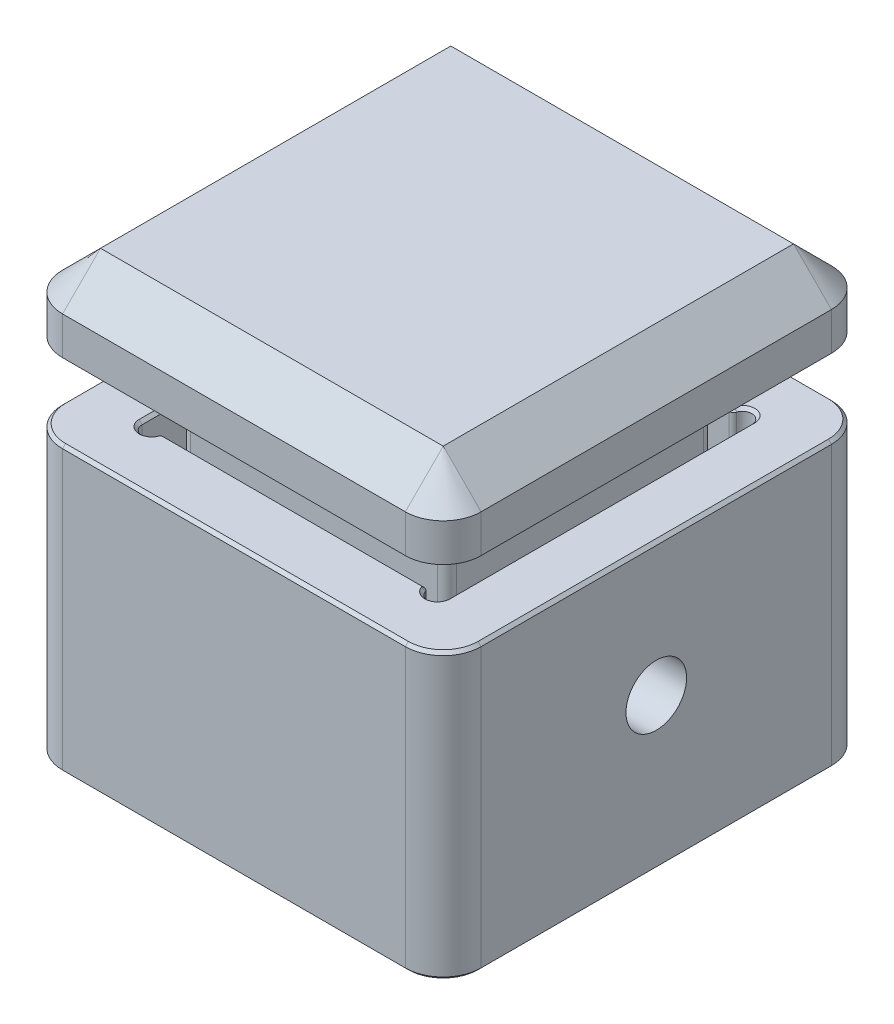
from build123d import *

# Parameters (mm, degrees)
SKETCH1_W           = 35.052
SKETCH1_H           = 35.687
BOSS_EXTRUDE1_DEPTH = 23.8125
FILLET1_R           = 3.175
FILLET2_R           = 0.4
SKETCH2_W           = 22.2758
SKETCH2_H           = 22.2758
BOSS_EXTRUDE2_DEPTH = 6.35
SKETCH2_4_W         = 22.2758
SKETCH2_4_H         = 22.2758
BOSS_EXTRUDE3_DEPTH = 30.1625
CHAMFER1_SIZE       = 3.175
CHAMFER2_SIZE       = 4.7625
CHAMFER3_SIZE       = 0.254
FILLET3_R           = 0.810638298
SKETCH3_R           = 2.54
CUT_EXTRUDE1_DEPTH  = 60.148912156


with BuildPart() as part:
    # Sketch1 → Boss-Extrude1 (new body)
    with BuildSketch(Plane(origin=(0, 0, 0), x_dir=(1, 0, 0), z_dir=(0, 1, 0))):
        with Locations((12.7635, 12.7635)):
            Rectangle(SKETCH1_W, SKETCH1_H)
        with BuildLine():
            Line((1.599999848, 0), (23.927000152, 0))
            ThreePointArc((23.927000152, 0), (24.727000076, -0.799999924), (25.527, 0))
            Line((25.527, 0), (25.527, 25.527))
            ThreePointArc((25.527, 25.527), (24.727000076, 26.326999924), (23.927000152, 25.527))
            Line((23.927000152, 25.527), (1.599999848, 25.527))
            ThreePointArc((1.599999848, 25.527), (0.799999924, 26.326999924), (0, 25.527))
            Line((0, 25.527), (0, 0))
            ThreePointArc((0, 0), (0.799999924, -0.799999924), (1.599999848, 0))
        make_face(mode=Mode.SUBTRACT)
    extrude(amount=BOSS_EXTRUDE1_DEPTH)

    # Fillet1
    fillet1_edges = [part.edges().sort_by_distance(p)[0] for p in [
        (-4.7625, 11.90625, -30.607),
        (30.2895, 11.90625, -30.607),
        (30.2895, 11.90625, 5.08),
        (-4.7625, 11.90625, 5.08),
    ]]
    fillet(fillet1_edges, radius=FILLET1_R)

    # Fillet2
    fillet2_edges = [part.edges().sort_by_distance(p)[0] for p in [
        (1.599999848, 11.90625, 0),
        (23.927000152, 11.90625, 0),
        (23.927000152, 11.90625, -25.527),
        (1.599999848, 11.90625, -25.527),
    ]]
    fillet(fillet2_edges, radius=FILLET2_R)

    # Chamfer3
    chamfer3_edges = [part.edges().sort_by_distance(p)[0] for p in [
        (0.664718345, 0, 0.788478771),
        (25.527, 0, -12.7635),
        (24.862281655, 0, -26.315478771),
        (0, 0, -12.7635),
        (0.664718345, 23.8125, 0.788478771),
        (25.527, 23.8125, -12.7635),
        (24.862281655, 23.8125, -26.315478771),
        (0, 23.8125, -12.7635),
        (-4.7625, 0, -12.7635),
        (-4.7625, 23.8125, -12.7635),
        (12.7635, 0, -30.607),
        (30.2895, 0, -12.7635),
        (12.7635, 0, 5.08),
        (-3.83256403, 0, 4.15006403),
        (29.35956403, 0, 4.15006403),
        (29.35956403, 0, -29.67706403),
        (-3.83256403, 0, -29.67706403),
        (12.7635, 23.8125, -30.607),
        (12.7635, 23.8125, 5.08),
        (30.2895, 23.8125, -12.7635),
        (-3.83256403, 23.8125, 4.15006403),
        (29.35956403, 23.8125, 4.15006403),
        (29.35956403, 23.8125, -29.67706403),
        (-3.83256403, 23.8125, -29.67706403),
        (12.7635, 0, 0),
        (12.7635, 23.8125, 0),
        (24.862281655, 0, 0.788478771),
        (12.7635, 0, -25.527),
        (0.664718345, 0, -26.315478771),
        (1.700430589, 0, 0.073401365),
        (1.700430589, 0, -25.600401365),
        (23.826569411, 0, -25.600401365),
        (23.826569411, 0, 0.073401365),
        (24.862281655, 23.8125, 0.788478771),
        (0.664718345, 23.8125, -26.315478771),
        (12.7635, 23.8125, -25.527),
        (1.700430589, 23.8125, 0.073401365),
        (1.700430589, 23.8125, -25.600401365),
        (23.826569411, 23.8125, -25.600401365),
        (23.826569411, 23.8125, 0.073401365),
    ]]
    chamfer(chamfer3_edges, length=CHAMFER3_SIZE)


with BuildPart() as body_2:
    # Sketch2 → Boss-Extrude2 (new body)
    # profile 1 of 2: a face of its own
    with BuildSketch(Plane(origin=(0, 30.1625, 0), x_dir=(1, 0, 0), z_dir=(0, 1, 0))):
        with BuildLine():
            Line((30.2895, -1.905), (30.2895, 27.432))
            ThreePointArc((30.2895, 27.432), (29.35956403, 29.67706403), (27.1145, 30.607))
            Line((27.1145, 30.607), (-1.5875, 30.607))
            ThreePointArc((-1.5875, 30.607), (-3.83256403, 29.67706403), (-4.7625, 27.432))
            Line((-4.7625, 27.432), (-4.7625, -1.905))
            ThreePointArc((-4.7625, -1.905), (-3.83256403, -4.15006403), (-1.5875, -5.08))
            Line((-1.5875, -5.08), (27.1145, -5.08))
            ThreePointArc((27.1145, -5.08), (29.35956403, -4.15006403), (30.2895, -1.905))
        make_face()
        with Locations((12.7635, 12.7635)):
            Rectangle(SKETCH2_W, SKETCH2_H, mode=Mode.SUBTRACT)
    # profile 2 of 2: a face of its own
    with BuildSketch(Plane(origin=(0, 30.1625, 0), x_dir=(1, 0, 0), z_dir=(0, 1, 0))):
        with Locations((12.7635, 12.7635)):
            Rectangle(SKETCH2_W, SKETCH2_H)
    extrude(amount=BOSS_EXTRUDE2_DEPTH)

    # Sketch2<4> → Boss-Extrude3 (add)
    with BuildSketch(Plane(origin=(0, 30.1625, 0), x_dir=(1, 0, 0), z_dir=(0, 1, 0))):
        with Locations((12.7635, 12.7635)):
            Rectangle(SKETCH2_4_W, SKETCH2_4_H)
    extrude(amount=-BOSS_EXTRUDE3_DEPTH)

    # Chamfer1
    chamfer1_edges = [body_2.edges().sort_by_distance(p)[0] for p in [
        (29.35956403, 36.5125, -29.67706403),
        (12.7635, 36.5125, -30.607),
        (-3.83256403, 36.5125, -29.67706403),
        (-4.7625, 36.5125, -12.7635),
        (-3.83256403, 36.5125, 4.15006403),
        (12.7635, 36.5125, 5.08),
        (29.35956403, 36.5125, 4.15006403),
        (30.2895, 36.5125, -12.7635),
    ]]
    chamfer(chamfer1_edges, length=CHAMFER1_SIZE - 0.0001)  # a hair under: the kernel refuses the full size

    # Chamfer2
    chamfer2_edges = [body_2.edges().sort_by_distance(p)[0] for p in [
        (1.6256, 0, -12.7635),
        (12.7635, 0, -23.9014),
        (23.9014, 0, -12.7635),
        (12.7635, 0, -1.6256),
    ]]
    chamfer(chamfer2_edges, length=CHAMFER2_SIZE)

    # Fillet3
    fillet3_edges = [body_2.edges().sort_by_distance(p)[0] for p in [
        (1.6256, 17.4625, -23.9014),
        (1.6256, 17.4625, -1.6256),
        (23.9014, 17.4625, -1.6256),
        (23.9014, 17.4625, -23.9014),
    ]]
    fillet(fillet3_edges, radius=FILLET3_R)


with BuildPart() as cut_extrude1_tool:
    # Sketch3 → Cut-Extrude1 (new, through all)
    with BuildSketch(Plane(origin=(30.2895, 0, 0), x_dir=(0, 0, -1), z_dir=(1, 0, 0))):
        with Locations((12.7635, 12.7)):
            Circle(SKETCH3_R)
    extrude(amount=-CUT_EXTRUDE1_DEPTH)


with BuildPart() as part_1:
    add(part.part)

    # Cut-Extrude1: cut by cut_extrude1_tool
    add(cut_extrude1_tool.part, mode=Mode.SUBTRACT)


with BuildPart() as body_2_1:
    add(body_2.part)

    # Cut-Extrude1: cut by cut_extrude1_tool
    add(cut_extrude1_tool.part, mode=Mode.SUBTRACT)


solid = Compound([part_1.part, body_2_1.part])
